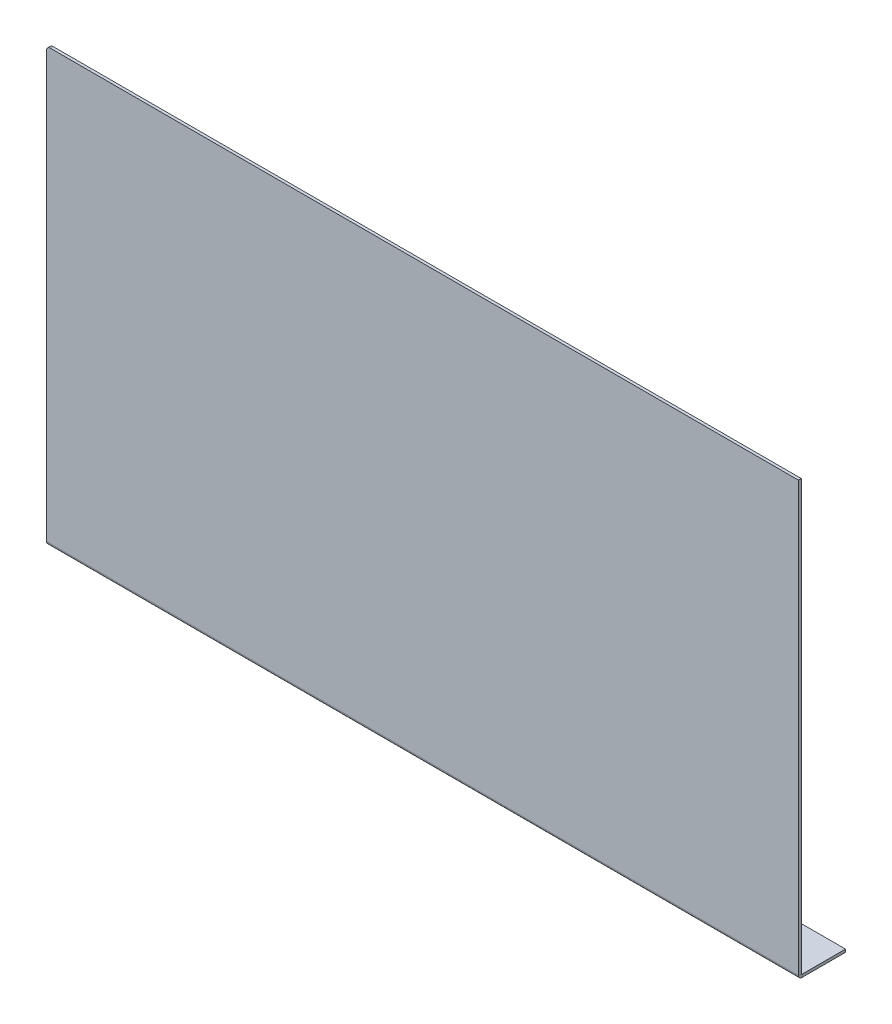
from build123d import *

# Parameters (mm, degrees)
SKETCH_1_W                        = 400
SKETCH_1_H                        = 230
SM_BASE_FLANGE_1_DEPTH            = 1.5
SM_EDGE_FLANGE_1_STRIP_W          = 6.6
SM_EDGE_FLANGE_1_STRIP_H          = 1.5
SM_EDGE_FLANGE_1_STRIP_CUT_DEPTH  = 400
SM_EDGE_FLANGE_1_DEPTH            = 400
SM_EDGE_FLANGE_2_STRIP_W          = 7
SM_EDGE_FLANGE_2_STRIP_H          = 1.5
SM_EDGE_FLANGE_2_STRIP_CUT_DEPTH  = 353
SM_EDGE_FLANGE_2_RELIEF_W         = 7.75
SM_EDGE_FLANGE_2_RELIEF_H         = 0.75
SM_EDGE_FLANGE_2_RELIEF_CUT_DEPTH = 1.5
SM_EDGE_FLANGE_2_DEPTH            = 353
FILLET_1_R                        = 2
SM_START                          = -176.5
SM_EDGE_FLANGE_3_DEPTH            = 353
SM_EDGE_FLANGE_3_2_DEPTH          = 353


# Read off the part's stored shape, not the designer's step: 边线-法兰3
# Sheet-metal steps are written as plain solids
with BuildPart() as part:
    # Sketch 1 → 基体-法兰1 (new body)
    with BuildSketch(Plane.XY):
        Rectangle(SKETCH_1_W, SKETCH_1_H)
    extrude(amount=-SM_BASE_FLANGE_1_DEPTH)

    # 边线-法兰1 strip (across the edge) → 边线-法兰1 strip cut (cut)
    with BuildSketch(Plane(origin=(200, -115, -1.5), x_dir=(0, 1, 0), z_dir=(-1, 0, 0))):
        with Locations((-1.5, -0.75)):
            Rectangle(SM_EDGE_FLANGE_1_STRIP_W, SM_EDGE_FLANGE_1_STRIP_H)
    extrude(amount=SM_EDGE_FLANGE_1_STRIP_CUT_DEPTH, mode=Mode.SUBTRACT)

    # 边线-法兰1 section (across the edge) → 边线-法兰1 (add)
    with BuildSketch(Plane(origin=(200, -115, -1.5), x_dir=(0, 1, 0), z_dir=(-1, 0, 0))):
        with BuildLine():
            Line((0, 0.3), (0, 23.5))
            Line((0, 23.5), (1.5, 23.5))
            Line((1.5, 23.5), (1.5, 0.3))
            ThreePointArc((1.5, 0.3), (1.587867966, 0.087867966), (1.8, 0))
            Line((1.8, 0), (1.8, -1.5))
            ThreePointArc((1.8, -1.5), (0.527207794, -0.972792206), (0, 0.3))
        make_face()
    extrude(amount=SM_EDGE_FLANGE_1_DEPTH)

    # 边线-法兰2 strip (across the edge) → 边线-法兰2 strip cut (cut)
    with BuildSketch(Plane(origin=(-176.5, -115, -25), x_dir=(0, 0, 1), z_dir=(1, 0, 0))):
        with Locations((-1.5, -0.75)):
            Rectangle(SM_EDGE_FLANGE_2_STRIP_W, SM_EDGE_FLANGE_2_STRIP_H)
    extrude(amount=SM_EDGE_FLANGE_2_STRIP_CUT_DEPTH, mode=Mode.SUBTRACT)

    # 边线-法兰2 relief (on the sheet) → 边线-法兰2 relief cut (cut)
    with BuildSketch(Plane(origin=(-176.5, -115, -23), x_dir=(0, 0, 1), z_dir=(0, -1, 0))):
        with Locations((-3.125, 0.375)):
            Rectangle(SM_EDGE_FLANGE_2_RELIEF_W, SM_EDGE_FLANGE_2_RELIEF_H)
        with Locations((-3.125, -353.375)):
            Rectangle(SM_EDGE_FLANGE_2_RELIEF_W, SM_EDGE_FLANGE_2_RELIEF_H)
    extrude(amount=-SM_EDGE_FLANGE_2_RELIEF_CUT_DEPTH, mode=Mode.SUBTRACT)

    # 边线-法兰2 section (across the edge) → 边线-法兰2 (add)
    with BuildSketch(Plane(origin=(-176.5, -115, -25), x_dir=(0, 0, 1), z_dir=(1, 0, 0))):
        with BuildLine():
            Line((0, 0.5), (0, 9.5))
            Line((0, 9.5), (1.5, 9.5))
            Line((1.5, 9.5), (1.5, 0.5))
            ThreePointArc((1.5, 0.5), (1.646446609, 0.146446609), (2, 0))
            Line((2, 0), (2, -1.5))
            ThreePointArc((2, -1.5), (0.585786438, -0.914213562), (0, 0.5))
        make_face()
    extrude(amount=SM_EDGE_FLANGE_2_DEPTH)

    # 圆角1
    fillet_1_edges = [part.edges().sort_by_distance(p)[0] for p in [
        (-200, 115, -0.75),
    ]]
    fillet(fillet_1_edges, radius=FILLET_1_R)

    # 边线-法兰3 outline → 边线-法兰3 (cut)
    with BuildSketch(Plane.YZ.offset(SM_START)):
        with BuildLine():
            ThreePointArc((-122.171572875, -25), (-122.93693974, -24.847759065), (-123.585786438, -24.414213562))
            Line((-123.585786438, -24.414213562), (-124.5, -23.5))
            Line((-124.5, -23.5), (-124.5, -25))
            Line((-124.5, -25), (-122.171572875, -25))
        make_face()
    extrude(amount=SM_EDGE_FLANGE_3_DEPTH, mode=Mode.SUBTRACT)

    # Sm Edge Flange 3 2 outline → Sm Edge Flange 3 2 (add)
    with BuildSketch(Plane.YZ.offset(SM_START)):
        with BuildLine():
            Line((-129.096194078, -18.903805922), (-124.5, -23.5))
            Line((-124.5, -23.5), (-122.171572875, -23.5))
            ThreePointArc((-122.171572875, -23.5), (-122.362914591, -23.461939766), (-122.525126266, -23.353553391))
            Line((-122.525126266, -23.353553391), (-128.035533906, -17.843145751))
            Line((-128.035533906, -17.843145751), (-129.096194078, -18.903805922))
        make_face()
    extrude(amount=SM_EDGE_FLANGE_3_2_DEPTH)


solid = part.part
